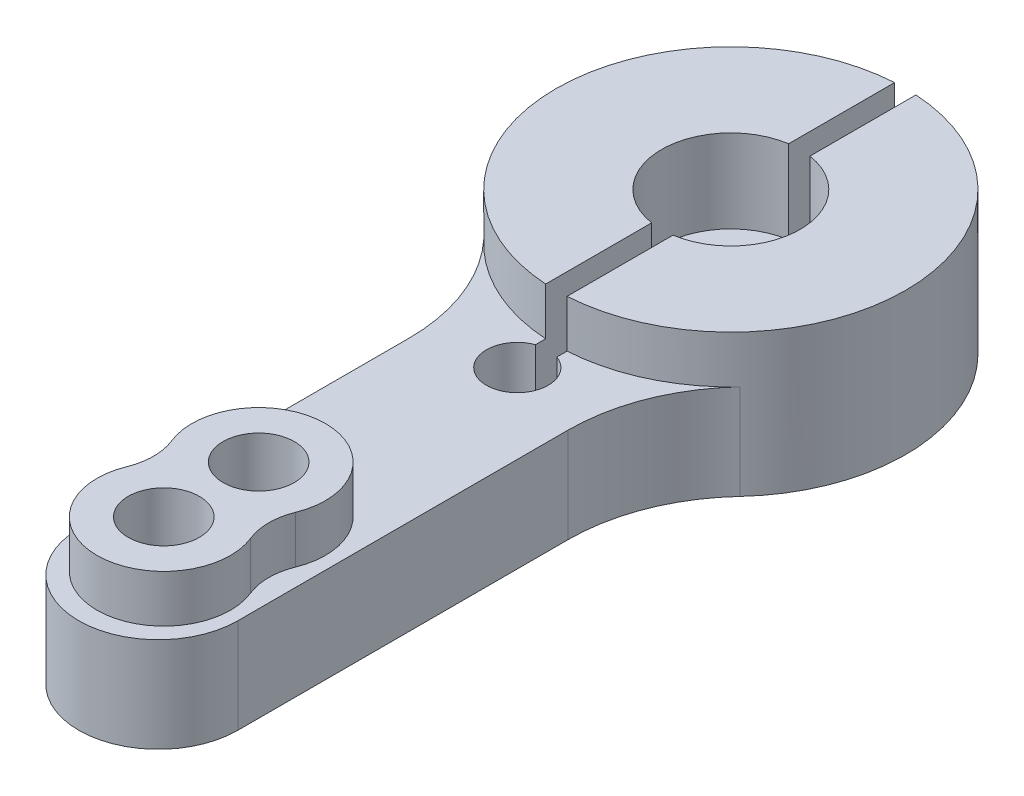
from build123d import *

# Parameters (mm, degrees)
SKETCH1_R           = 1.5000000000000018
SKETCH1_R_2         = 1.5000000000000004
BOSS_EXTRUDE1_DEPTH = 4
BOSS_EXTRUDE2_START = 2
BOSS_EXTRUDE2_DEPTH = 2
BOSS_EXTRUDE3_START = 2
SKETCH3_R           = 1.5000000000000007
SKETCH3_R_2         = 1.500000000000001
BOSS_EXTRUDE3_DEPTH = 2
SKETCH4_R           = 2.921
CUT_EXTRUDE1_DEPTH  = 3.5052
FILLET1_R           = 7.62
SKETCH5_R           = 3.8735000000000004
CUT_EXTRUDE2_DEPTH  = 1.3716


with BuildPart() as part:
    # Sketch1 → Boss-Extrude1 (new body)
    with BuildSketch(Plane(origin=(0, 0, 0), x_dir=(1, 0, 0), z_dir=(0, 1, 0))):
        with BuildLine():
            Line((-3.3528000000000002, -24.130000000000003), (-3.3527999999999993, -6.55871086113727))
            ThreePointArc((-3.3527999999999993, -6.55871086113727), (-7.210684523422123, 1.504654346911835), (-0.45, 7.352241562952077))
            Line((-0.45, 7.352241562952077), (-0.45, 1.325707358356285))
            ThreePointArc((-0.45, 1.325707358356285), (-1.4, 1.7e-16), (-0.45, -1.325707358356285))
            Line((-0.45, -1.325707358356285), (-0.45, -7.780368908234952))
            ThreePointArc((-0.45, -7.780368908234952), (-2.4e-16, -10.3), (0.45000000000000184, -7.780368908234953))
            Line((0.45000000000000184, -7.780368908234953), (0.45000000000000107, -1.3257073583562848))
            ThreePointArc((0.45000000000000107, -1.3257073583562848), (1.4, 0), (0.45000000000000073, 1.3257073583562848))
            Line((0.45000000000000073, 1.3257073583562848), (0.45, 7.352241562952076))
            ThreePointArc((0.45, 7.352241562952076), (7.210684523422123, 1.504654346911832), (3.3527999999999993, -6.55871086113727))
            Line((3.3527999999999993, -6.55871086113727), (3.3528000000000002, -24.130000000000003))
            ThreePointArc((3.3528000000000002, -24.130000000000003), (-6.2e-16, -27.482800000000005), (-3.3528000000000002, -24.130000000000003))
        make_face()
        with Locations((-4.6e-16, -23.9)):
            Circle(SKETCH1_R, mode=Mode.SUBTRACT)
        with Locations((0, -19.9)):
            Circle(SKETCH1_R_2, mode=Mode.SUBTRACT)
    extrude(amount=-BOSS_EXTRUDE1_DEPTH)

    # Sketch2 → Boss-Extrude2 (add)
    with BuildSketch(Plane(origin=(0, 0, 0), x_dir=(1, 0, 0), z_dir=(0, 1, 0)).offset(BOSS_EXTRUDE2_START)):
        with BuildLine():
            Line((-0.44999999999999873, 7.352241562952076), (-0.4499999999999986, 1.325707358356285))
            ThreePointArc((-0.4499999999999986, 1.325707358356285), (-1.3999999999999995, 1.7e-16), (-0.4499999999999986, -1.3257073583562848))
            Line((-0.4499999999999986, -1.3257073583562848), (-0.44999999999999873, -7.352241562952076))
            ThreePointArc((-0.44999999999999873, -7.352241562952076), (-7.366, 9e-16), (-0.44999999999999873, 7.352241562952076))
        make_face()
        with BuildLine():
            Line((0.45, 7.352241562952076), (0.4499999999999999, 1.3257073583562846))
            ThreePointArc((0.4499999999999999, 1.3257073583562846), (1.3999999999999995, 0), (0.4499999999999999, -1.3257073583562846))
            Line((0.4499999999999999, -1.3257073583562846), (0.45, -7.352241562952076))
            ThreePointArc((0.45, -7.352241562952076), (7.366, 0), (0.45, 7.352241562952076))
        make_face()
    extrude(amount=-BOSS_EXTRUDE2_DEPTH)

    # Sketch3 → Boss-Extrude3 (add)
    with BuildSketch(Plane(origin=(0, 0, 0), x_dir=(1, 0, 0), z_dir=(0, 1, 0)).offset(BOSS_EXTRUDE3_START)):
        with BuildLine():
            ThreePointArc((2.611298533252736, -20.95135387488328), (8e-16, -17.085), (-2.6112985332527363, -20.95135387488328))
            ThreePointArc((-2.6112985332527363, -20.95135387488328), (-2.427496854553608, -21.899999999999995), (-2.611298533252737, -22.84864612511671))
            ThreePointArc((-2.611298533252737, -22.84864612511671), (-9.8e-16, -26.715), (2.611298533252737, -22.84864612511671))
            ThreePointArc((2.611298533252737, -22.84864612511671), (2.427496854553609, -21.899999999999995), (2.611298533252736, -20.95135387488328))
        make_face()
        with Locations((0, -19.9)):
            Circle(SKETCH3_R, mode=Mode.SUBTRACT)
        with Locations((-4.6e-16, -23.9)):
            Circle(SKETCH3_R_2, mode=Mode.SUBTRACT)
    extrude(amount=-BOSS_EXTRUDE3_DEPTH)

    # Sketch4 → Cut-Extrude1 (cut)
    with BuildSketch(Plane(origin=(0, 2, 0), x_dir=(1, 0, 0), z_dir=(0, 1, 0))):
        Circle(SKETCH4_R)
    extrude(amount=-CUT_EXTRUDE1_DEPTH, mode=Mode.SUBTRACT)

    # Fillet1
    fillet1_edges = [part.edges().sort_by_distance(p)[0] for p in [
        (-3.3527999999999993, -2, 6.558710861137271),
        (3.352800000000001, -2, 6.55871086113727),
    ]]
    fillet(fillet1_edges, radius=FILLET1_R)

    # Sketch5 → Cut-Extrude2 (cut)
    with BuildSketch(Plane.XZ.offset(4)):
        Circle(SKETCH5_R)
    extrude(amount=-CUT_EXTRUDE2_DEPTH, mode=Mode.SUBTRACT)


solid = part.part
